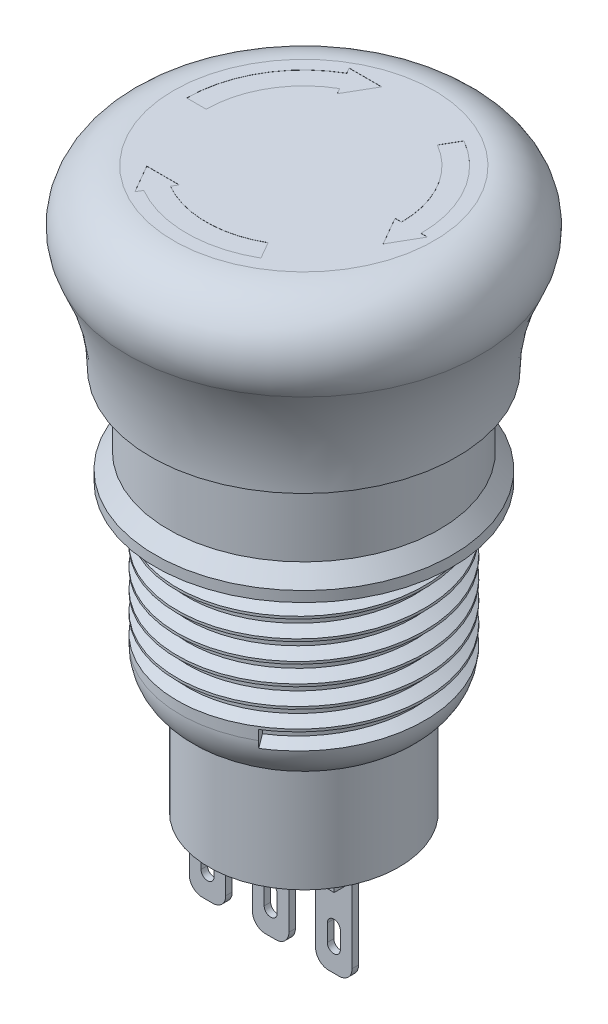
from build123d import *
from build123d.topology import SkipClean

# Parameters (mm, degrees)
SKETCH5_R                   = 7.3
BOSS_EXTRUDE1_DEPTH         = 8
SKETCH7_W                   = 2.8
SKETCH7_H                   = 0.5
BOSS_EXTRUDE3_DEPTH         = 7
CUT_EXTRUDE1_REACH          = 44.259
BOSS_EXTRUDE4_DEPTH         = 0.1
SKETCH6_W                   = 12
SKETCH6_H                   = 2.75
Y_KSEKLIK_EKSTR_ZYON1_DEPTH = 0.5
RADYUS1_R                   = 1
RADYUS2_R                   = 3.5
KES_EKSTR_ZYON1_DEPTH       = 0.01
DI_1_PITCH                  = 1.5


with BuildPart() as part:
    # Sketch1 → Revolve1 (revolve)
    with BuildSketch(Plane.XY):
        with BuildLine():
            Line((0, 0), (-11.75, 0))
            ThreePointArc((-11.75, 0), (-12.212495616, 3.959540512), (-13.575081967, 7.705901639))
            ThreePointArc((-13.575081967, 7.705901639), (-13.404144051, 11.600429308), (-10, 13.5))
            Line((-10, 13.5), (0, 13.5))
            Line((0, 13.5), (0, 0))
        make_face()
    revolve(axis=Axis((0, 13.5, 0), (0, -1, 0)))

    # Sketch2 → Revolve2 (revolve)
    with BuildSketch(Plane.XY, mode=Mode.PRIVATE) as revolve2_sk:
        Polygon((0, 0), (-10.4, 0), (-10.4, -5.5), (-11.4, -6.7), (-11.4, -7.5), (-9.5, -7.5), (-9.5, -21.5), (0, -21.5), align=None)
    revolve(revolve2_sk.sketch.rotate(Axis((0, -21.5, 0), (0, 1, 0)), 270), axis=Axis((0, -21.5, 0), (0, 1, 0)))

    # Sketch5 → Boss-Extrude1 (add)
    with BuildSketch(Plane.XZ.offset(21.5)):
        with Locations(Location((0, 0, 0), (0, 0, 270))):
            Circle(SKETCH5_R)
    extrude(amount=BOSS_EXTRUDE1_DEPTH)

    # Sketch7 → Boss-Extrude3 (add)
    with BuildSketch(Plane.XZ.offset(29.5)):
        with Locations((-4.85, 2.3)):
            Rectangle(SKETCH7_W, SKETCH7_H)
        with Locations((0, 2.3)):
            Rectangle(SKETCH7_W, SKETCH7_H)
        with Locations((4.85, 2.3)):
            Rectangle(SKETCH7_W, SKETCH7_H)
    extrude(amount=BOSS_EXTRUDE3_DEPTH)

    # Sketch8 → Cut-Extrude1 (cut, up to next)
    with BuildSketch(Plane(origin=(0, 0, 2.05), x_dir=(-1, 0, 0), z_dir=(0, 0, -1)), mode=Mode.PRIVATE) as cut_extrude1_sk1:
        with BuildLine():
            Line((-4.35, -33.4), (-4.35, -34.7))
            ThreePointArc((-4.35, -34.7), (-4.85, -35.2), (-5.35, -34.7))
            Line((-5.35, -34.7), (-5.35, -33.4))
            ThreePointArc((-5.35, -33.4), (-4.85, -32.9), (-4.35, -33.4))
        make_face()
    cut_extrude1_tool1 = extrude(cut_extrude1_sk1.sketch, amount=-CUT_EXTRUDE1_REACH, mode=Mode.PRIVATE) & part.part
    # Sketch8 → Cut-Extrude1 (cut, up to next)
    with BuildSketch(Plane(origin=(0, 0, 2.05), x_dir=(-1, 0, 0), z_dir=(0, 0, -1)), mode=Mode.PRIVATE) as cut_extrude1_sk2:
        with BuildLine():
            Line((0.5, -33.4), (0.5, -34.7))
            ThreePointArc((0.5, -34.7), (0, -35.2), (-0.5, -34.7))
            Line((-0.5, -34.7), (-0.5, -33.4))
            ThreePointArc((-0.5, -33.4), (0, -32.9), (0.5, -33.4))
        make_face()
    cut_extrude1_tool2 = extrude(cut_extrude1_sk2.sketch, amount=-CUT_EXTRUDE1_REACH, mode=Mode.PRIVATE) & part.part
    # Sketch8 → Cut-Extrude1 (cut, up to next)
    with BuildSketch(Plane(origin=(0, 0, 2.05), x_dir=(-1, 0, 0), z_dir=(0, 0, -1)), mode=Mode.PRIVATE) as cut_extrude1_sk3:
        with BuildLine():
            Line((5.35, -33.4), (5.35, -34.7))
            ThreePointArc((5.35, -34.7), (4.85, -35.2), (4.35, -34.7))
            Line((4.35, -34.7), (4.35, -33.4))
            ThreePointArc((4.35, -33.4), (4.85, -32.9), (5.35, -33.4))
        make_face()
    cut_extrude1_tool3 = extrude(cut_extrude1_sk3.sketch, amount=-CUT_EXTRUDE1_REACH, mode=Mode.PRIVATE) & part.part
    add(cut_extrude1_tool1.solids().sort_by_distance((4.85, -34.05, 2.05))[0], mode=Mode.SUBTRACT)
    add(cut_extrude1_tool2.solids().sort_by_distance((0, -34.05, 2.05))[0], mode=Mode.SUBTRACT)
    add(cut_extrude1_tool3.solids().sort_by_distance((-4.85, -34.05, 2.05))[0], mode=Mode.SUBTRACT)

    # Sketch10 → Boss-Extrude4 (add)
    # profile 1 of 5: a face of its own
    with BuildSketch(Plane.XZ.offset(29.5)):
        Polygon((-5.694051878, 0.467037209), (-4.106551878, 0.467037209), (-4.106551878, 0.437144381), (-5.356008508, -0.611648688), (-4.106551878, -0.611648688), (-4.106551878, -0.754116637), (-5.694051878, -0.754116637), (-5.694051878, -0.721679738), (-4.447457326, 0.32456926), (-5.694051878, 0.32456926), align=None)
    # profile 2 of 5: a face of its own
    with BuildSketch(Plane.XZ.offset(29.5)):
        with BuildLine():
            Line((-4.397847951, -2.626552534), (-4.493250596, -2.501893079))
            add(Edge.make_bspline(
                [(-4.493250596, -2.501893079), (-4.482652459, -2.493000408), (-4.461599073, -2.475334959), (-4.432035493, -2.446914535), (-4.404338036, -2.417295576), (-4.378374755, -2.386489403), (-4.355053579, -2.353941517), (-4.333159185, -2.320440369), (-4.313534176, -2.285425541), (-4.289738464, -2.237006004), (-4.264907172, -2.17366573), (-4.244086778, -2.093930214), (-4.230832888, -2.010694823), (-4.229397406, -1.953908769), (-4.228667262, -1.92502509)],
                knots=[0, 0, 0, 0, 0.757959112, 1.505699292, 2.245454638, 2.979532153, 3.711538275, 4.438200793, 5.171680507, 5.909471876, 7.393775596, 8.890124382, 10.418191784, 12, 12, 12, 12], degree=3))
            add(Edge.make_bspline(
                [(-4.228667262, -1.92502509), (-4.228851315, -1.909112502), (-4.229217712, -1.877435008), (-4.234017507, -1.830420167), (-4.240841369, -1.784194193), (-4.250720327, -1.738928984), (-4.263581834, -1.694714416), (-4.278664949, -1.651213832), (-4.297434354, -1.608939552), (-4.318162656, -1.567382817), (-4.341581828, -1.527570513), (-4.367118019, -1.489893252), (-4.394520596, -1.454523163), (-4.423718823, -1.421362236), (-4.455075576, -1.39077415), (-4.48822198, -1.362268688), (-4.523556994, -1.336359583), (-4.560417938, -1.312410165), (-4.598858991, -1.291099467), (-4.638638328, -1.272696648), (-4.679603856, -1.256923901), (-4.721839497, -1.24432761), (-4.765179043, -1.234392128), (-4.809714471, -1.227528245), (-4.855359334, -1.222771629), (-4.886297088, -1.222408603), (-4.901891922, -1.222225611)],
                knots=[0, 0, 0, 0, 1.055000685, 2.100209969, 3.131349012, 4.153242145, 5.170189196, 6.184191144, 7.204341339, 8.235672124, 9.263040994, 10.265373269, 11.252624173, 12.22887325, 13.193405896, 14.155809299, 15.126090485, 16.097288279, 17.069732292, 18.038585918, 19.002221264, 19.978698174, 20.959418239, 21.948869816, 22.966084182, 24, 24, 24, 24], degree=3))
            add(Edge.make_bspline(
                [(-4.901891922, -1.222225611), (-4.92535577, -1.222797936), (-4.971423925, -1.223921621), (-5.038902023, -1.233922115), (-5.103545329, -1.249119067), (-5.164949757, -1.271895418), (-5.223872477, -1.29998013), (-5.279316528, -1.335467836), (-5.332119756, -1.376568909), (-5.381034236, -1.423864806), (-5.425717247, -1.475756015), (-5.465064832, -1.531430961), (-5.497864797, -1.590750977), (-5.525158887, -1.653061092), (-5.546139617, -1.718840793), (-5.560909773, -1.787971793), (-5.570544619, -1.860303734), (-5.571467042, -1.90972914), (-5.571936493, -1.934883364)],
                knots=[0, 0, 0, 0, 1.029171465, 2.020641659, 2.987623507, 3.938342917, 4.889210282, 5.84687017, 6.821220943, 7.821438502, 8.827599549, 9.822697543, 10.807740252, 11.797342354, 12.80366471, 13.83203677, 14.896651826, 16, 16, 16, 16], degree=3))
            add(Edge.make_bspline(
                [(-5.571936493, -1.934883364), (-5.571170511, -1.962597798), (-5.569662875, -2.017146433), (-5.556890644, -2.097141931), (-5.536181517, -2.173721011), (-5.507199245, -2.246887791), (-5.469523203, -2.316436005), (-5.423849523, -2.382474491), (-5.369743744, -2.445058989), (-5.328431039, -2.482692392), (-5.30735316, -2.501893079)],
                knots=[0, 0, 0, 0, 1.028121516, 2.023589091, 2.998037872, 3.967518031, 4.937445131, 5.927275754, 6.942489185, 8, 8, 8, 8], degree=3))
            Line((-5.30735316, -2.501893079), (-5.401801778, -2.626552534))
            add(Edge.make_bspline(
                [(-5.401801778, -2.626552534), (-5.414746026, -2.616520405), (-5.440572521, -2.5965042), (-5.476981147, -2.564092687), (-5.511228846, -2.529949794), (-5.54303217, -2.493817494), (-5.573055047, -2.456127932), (-5.600290983, -2.416217223), (-5.62556963, -2.374774704), (-5.64840987, -2.331559089), (-5.668888651, -2.286712262), (-5.686177405, -2.240280894), (-5.701284551, -2.192658353), (-5.713630864, -2.143820658), (-5.723282737, -2.093604654), (-5.7297313, -2.042182635), (-5.734150244, -1.989446052), (-5.734552938, -1.95386725), (-5.734757006, -1.93583739)],
                knots=[0, 0, 0, 0, 0.986756325, 1.968786143, 2.935506311, 3.899499537, 4.868307269, 5.8376204, 6.809456583, 7.792545619, 8.781780509, 9.778496008, 10.776623214, 11.79151764, 12.812666265, 13.856269958, 14.913646641, 16, 16, 16, 16], degree=3))
            add(Edge.make_bspline(
                [(-5.734757006, -1.93583739), (-5.734638174, -1.918763298), (-5.734403197, -1.885001396), (-5.73059675, -1.835154462), (-5.725403476, -1.786627045), (-5.717583846, -1.73955784), (-5.708356234, -1.693689987), (-5.695986771, -1.649439293), (-5.682130542, -1.606370323), (-5.665845066, -1.564656111), (-5.647468083, -1.524261176), (-5.626698341, -1.485315804), (-5.603710495, -1.447837908), (-5.579011258, -1.411459021), (-5.551807267, -1.376716545), (-5.52247633, -1.343309411), (-5.491117303, -1.311050288), (-5.468504566, -1.291091927), (-5.457135311, -1.281057242)],
                knots=[0, 0, 0, 0, 1.114604814, 2.203992996, 3.262667896, 4.300477797, 5.318619304, 6.316056647, 7.298880507, 8.271930387, 9.238335007, 10.195173496, 11.151986948, 12.108099108, 13.064862484, 14.031167946, 15.010108607, 16, 16, 16, 16], degree=3))
            add(Edge.make_bspline(
                [(-5.457135311, -1.281057242), (-5.437386272, -1.264984646), (-5.398126621, -1.233033498), (-5.334496908, -1.192155063), (-5.268063113, -1.157163136), (-5.198476217, -1.128871201), (-5.125892367, -1.106753818), (-5.050274973, -1.091431633), (-4.971694656, -1.081475013), (-4.918247255, -1.080336417), (-4.891079622, -1.079757663)],
                knots=[0, 0, 0, 0, 0.994628077, 1.977248131, 2.950237994, 3.925870899, 4.908910175, 5.911660606, 6.938484602, 8, 8, 8, 8], degree=3))
            add(Edge.make_bspline(
                [(-4.891079622, -1.079757663), (-4.862526022, -1.080466209), (-4.806348596, -1.08186023), (-4.723884073, -1.093606149), (-4.644990917, -1.112730775), (-4.569365565, -1.139065513), (-4.497440717, -1.173808072), (-4.428912604, -1.215866751), (-4.363837182, -1.265652359), (-4.303046445, -1.322539638), (-4.247467576, -1.384939538), (-4.198569375, -1.451758284), (-4.157876176, -1.522870322), (-4.123860032, -1.597490858), (-4.097714158, -1.676179023), (-4.079411103, -1.758766833), (-4.068018697, -1.845099127), (-4.066578514, -1.904001013), (-4.06584675, -1.933929337)],
                knots=[0, 0, 0, 0, 1.032901378, 2.032168977, 3.007206631, 3.966850309, 4.924221947, 5.891988639, 6.871730993, 7.884084801, 8.900290346, 9.89161143, 10.874607481, 11.860025555, 12.854717796, 13.869097222, 14.917278314, 16, 16, 16, 16], degree=3))
            add(Edge.make_bspline(
                [(-4.06584675, -1.933929337), (-4.06606527, -1.952169508), (-4.06649781, -1.98827409), (-4.070721179, -2.041682811), (-4.077748999, -2.0936832), (-4.087377587, -2.144401012), (-4.099179008, -2.194020161), (-4.114627981, -2.242031591), (-4.132568025, -2.288696743), (-4.152703152, -2.334050566), (-4.175722215, -2.377599625), (-4.200723331, -2.419335993), (-4.228283608, -2.458756199), (-4.257491903, -2.496601739), (-4.289440799, -2.532020589), (-4.323089854, -2.566024304), (-4.359437555, -2.597438267), (-4.385021048, -2.616830014), (-4.397847951, -2.626552534)],
                knots=[0, 0, 0, 0, 1.096705196, 2.170817488, 3.219277236, 4.250701065, 5.274195539, 6.284202015, 7.28098643, 8.279664616, 9.266225751, 10.241373748, 11.203306326, 12.157093976, 13.114198862, 14.069774147, 15.032234603, 16, 16, 16, 16], degree=3))
        make_face()
    # profile 3 of 5: a face of its own
    with BuildSketch(Plane.XZ.offset(29.5)):
        Polygon((-0.8, 0.467037209), (0.7875, 0.467037209), (0.7875, 0.437144381), (-0.461956631, -0.611648688), (0.7875, -0.611648688), (0.7875, -0.754116637), (-0.8, -0.754116637), (-0.8, -0.721679738), (0.446594551, 0.32456926), (-0.8, 0.32456926), align=None)
    # profile 4 of 5: a face of its own
    with BuildSketch(Plane.XZ.offset(29.5)):
        with BuildLine():
            add(Edge.make_bspline(
                [(0.828205128, -1.904036509), (0.827460593, -1.933431608), (0.825998265, -1.991166008), (0.814804625, -2.076017921), (0.795438863, -2.157023245), (0.769648727, -2.234843682), (0.735238586, -2.308541705), (0.693670663, -2.378697038), (0.644353762, -2.445111326), (0.5881154, -2.507175802), (0.526702721, -2.563762185), (0.46097539, -2.613201318), (0.39183344, -2.655001731), (0.319036276, -2.689262599), (0.242904304, -2.716164879), (0.16300465, -2.734722918), (0.079862309, -2.746578892), (0.023153649, -2.747964843), (-0.005613982, -2.748667919)],
                knots=[0, 0, 0, 0, 1.06508495, 2.091914715, 3.094501328, 4.079693967, 5.057647778, 6.035986298, 7.030177474, 8.050107388, 9.066943579, 10.051896531, 11.025616101, 11.9896488, 12.96281505, 13.945825876, 14.957941789, 16, 16, 16, 16], degree=3))
            add(Edge.make_bspline(
                [(-0.005613982, -2.748667919), (-0.034169706, -2.747964947), (-0.090456345, -2.746579308), (-0.173071054, -2.734709424), (-0.252488488, -2.716096138), (-0.328568358, -2.689512152), (-0.401419526, -2.655415873), (-0.470688566, -2.61333295), (-0.536871, -2.564221136), (-0.59858181, -2.507830339), (-0.655279356, -2.446432305), (-0.704795353, -2.380519627), (-0.747110429, -2.311445723), (-0.781136305, -2.238692566), (-0.808228979, -2.163071233), (-0.826718143, -2.083888658), (-0.83863985, -2.001498159), (-0.840009148, -1.945313923), (-0.840705128, -1.916756861)],
                knots=[0, 0, 0, 0, 1.04355943, 2.056976533, 3.044937463, 4.02179873, 4.997890911, 5.980248884, 6.980147982, 8.006253959, 9.032111064, 10.031228745, 11.015595249, 11.988180414, 12.962670953, 13.946861971, 14.95644057, 16, 16, 16, 16], degree=3))
            add(Edge.make_bspline(
                [(-0.840705128, -1.916756861), (-0.840002465, -1.887989346), (-0.838617328, -1.831280916), (-0.826740839, -1.748034567), (-0.808175992, -1.668077061), (-0.781619643, -1.591654586), (-0.747427885, -1.518742063), (-0.705411292, -1.449346545), (-0.655900508, -1.38338464), (-0.599584788, -1.321527589), (-0.538157247, -1.264998606), (-0.472677817, -1.215278101), (-0.403769244, -1.173503743), (-0.331715583, -1.139297551), (-0.256703081, -1.112241755), (-0.17825988, -1.093777503), (-0.096825541, -1.081832732), (-0.041379703, -1.080456148), (-0.013246194, -1.079757663)],
                knots=[0, 0, 0, 0, 1.053167129, 2.076072758, 3.073341244, 4.055601477, 5.033424535, 6.017524495, 7.021518915, 8.049444456, 9.077120685, 10.074910483, 11.055688766, 12.022980584, 12.991883888, 13.970269434, 14.970104079, 16, 16, 16, 16], degree=3))
            add(Edge.make_bspline(
                [(-0.013246194, -1.079757663), (0.005637282, -1.079999936), (0.043166009, -1.080481425), (0.098893519, -1.086286643), (0.153730826, -1.094693439), (0.207493595, -1.106804717), (0.260190605, -1.122427238), (0.311714088, -1.141679345), (0.362488445, -1.163742267), (0.411547351, -1.190011223), (0.458967807, -1.218671441), (0.504156859, -1.249922529), (0.54630731, -1.283982384), (0.586096449, -1.320364469), (0.622845166, -1.359572394), (0.657354668, -1.40101608), (0.689267726, -1.444912381), (0.717914076, -1.491330718), (0.744226097, -1.53908764), (0.766194469, -1.588529624), (0.785611564, -1.638613495), (0.801042397, -1.68978041), (0.813322345, -1.741912013), (0.82166626, -1.795073473), (0.827484377, -1.849210036), (0.827963844, -1.885682388), (0.828205128, -1.904036509)],
                knots=[0, 0, 0, 0, 1.037115869, 2.061148057, 3.07517727, 4.084041727, 5.086514338, 6.092668487, 7.104487461, 8.125783165, 9.147610153, 10.147694368, 11.141876323, 12.122903372, 13.107606018, 14.091946891, 15.084523921, 16.086505767, 17.087268121, 18.077809654, 19.05670789, 20.036870126, 21.011670792, 21.99694167, 22.991993299, 24, 24, 24, 24], degree=3))
        make_face()
        with BuildLine():
            add(Edge.make_bspline(
                [(0.665384615, -1.911032703), (0.665201056, -1.895967459), (0.664835693, -1.865980998), (0.660019415, -1.821402449), (0.653161796, -1.777407764), (0.643354876, -1.733999339), (0.63011589, -1.691410769), (0.614516569, -1.649216751), (0.596166332, -1.607619886), (0.574769499, -1.567085196), (0.551395782, -1.527680435), (0.525742318, -1.490242634), (0.497933498, -1.45514526), (0.468336659, -1.422275883), (0.436650664, -1.391730285), (0.403381225, -1.362889284), (0.367570598, -1.336913653), (0.330191675, -1.313107637), (0.29129265, -1.291804382), (0.251283182, -1.272860806), (0.209836873, -1.257364989), (0.16740338, -1.244727411), (0.124049908, -1.234249997), (0.079447576, -1.227612467), (0.033820507, -1.222744575), (0.002985881, -1.222399931), (-0.012610176, -1.222225611)],
                knots=[0, 0, 0, 0, 1.008585988, 2.007529826, 2.999688727, 3.990042337, 4.984966365, 5.984641633, 7.001812546, 8.027570247, 9.052811818, 10.068991095, 11.064725446, 12.050001529, 13.029093193, 14.010961114, 14.996492974, 15.989185205, 16.977398719, 17.96520407, 18.951579521, 19.937648295, 20.929603947, 21.935788061, 22.955928099, 24, 24, 24, 24], degree=3))
            add(Edge.make_bspline(
                [(-0.012610176, -1.222225611), (-0.035543755, -1.222803852), (-0.080661199, -1.223941431), (-0.146777464, -1.233900758), (-0.210317509, -1.249241439), (-0.27093366, -1.271855316), (-0.32914696, -1.300135773), (-0.384440993, -1.33507297), (-0.436830704, -1.376465484), (-0.485950344, -1.423484297), (-0.530783977, -1.474884239), (-0.57013738, -1.529463728), (-0.603434172, -1.586638042), (-0.630560044, -1.646556281), (-0.652054675, -1.708898557), (-0.666786054, -1.774066589), (-0.67648135, -1.841626262), (-0.677412421, -1.887677667), (-0.677884615, -1.911032703)],
                knots=[0, 0, 0, 0, 1.032063989, 2.030389145, 3.003944642, 3.970395727, 4.937377036, 5.913328081, 6.909231446, 7.93887556, 8.970685674, 9.976071282, 10.964166581, 11.944589148, 12.933237628, 13.927779006, 14.949070134, 16, 16, 16, 16], degree=3))
            add(Edge.make_bspline(
                [(-0.677884615, -1.911032703), (-0.677668941, -1.926730584), (-0.677241193, -1.957864198), (-0.672932856, -2.004171803), (-0.66602415, -2.049645181), (-0.656076902, -2.094220403), (-0.643628111, -2.137847422), (-0.628836398, -2.180706312), (-0.610391267, -2.222348111), (-0.589978885, -2.263269598), (-0.566876014, -2.302446728), (-0.541581134, -2.339616305), (-0.514269644, -2.374562841), (-0.48492982, -2.407362029), (-0.453814578, -2.438119275), (-0.420123894, -2.465999389), (-0.384841692, -2.492286205), (-0.347375582, -2.515996899), (-0.308394585, -2.537257799), (-0.268233567, -2.55574547), (-0.227030547, -2.571439558), (-0.184715691, -2.584106516), (-0.141372146, -2.594033302), (-0.096941126, -2.600873078), (-0.051511719, -2.605657561), (-0.02078504, -2.606018183), (-0.005295974, -2.60619997)],
                knots=[0, 0, 0, 0, 1.047226202, 2.076964084, 3.100341814, 4.114585567, 5.122123135, 6.126552355, 7.137064942, 8.158803602, 9.176592812, 10.169297945, 11.156925011, 12.133779169, 13.104132798, 14.073170763, 15.049307625, 16.038276215, 17.028988595, 18.010110019, 18.986169996, 19.968539974, 20.955178716, 21.950601663, 22.966915103, 24, 24, 24, 24], degree=3))
            add(Edge.make_bspline(
                [(-0.005295974, -2.60619997), (0.01008713, -2.606018037), (0.04060235, -2.605657139), (0.085714936, -2.600875373), (0.129826214, -2.594026041), (0.17276301, -2.584155098), (0.21453627, -2.57143235), (0.255106759, -2.555744525), (0.294625619, -2.537245479), (0.332995175, -2.516014605), (0.369813717, -2.492149571), (0.405011953, -2.466071825), (0.437928877, -2.437331114), (0.469377108, -2.406748594), (0.498685953, -2.373560376), (0.525865034, -2.337916767), (0.551570651, -2.300250596), (0.574758829, -2.260369052), (0.596177285, -2.219211169), (0.614512076, -2.176973724), (0.630183355, -2.134061207), (0.643300687, -2.090693327), (0.653171404, -2.046564577), (0.660016954, -2.001931936), (0.664836208, -1.956719116), (0.665201233, -1.926309833), (0.665384615, -1.911032703)],
                knots=[0, 0, 0, 0, 1.029967493, 2.04313025, 3.035375922, 4.01889446, 4.991458755, 5.958017022, 6.930036849, 7.912118993, 8.892942568, 9.867138445, 10.843712051, 11.817804417, 12.803729339, 13.806387533, 14.818654169, 15.856205545, 16.894655496, 17.924916651, 18.938004761, 19.953404357, 20.957695443, 21.963967554, 22.97713031, 24, 24, 24, 24], degree=3))
        make_face(mode=Mode.SUBTRACT)
    # profile 5 of 5: a face of its own
    with BuildSketch(Plane.XZ.offset(29.5)):
        with BuildLine():
            Line((5.644130399, -1.902297009), (5.532827314, -1.756860978))
            add(Edge.make_bspline(
                [(5.532827314, -1.756860978), (5.545191806, -1.746486195), (5.569754091, -1.725876504), (5.604244933, -1.692719343), (5.636558634, -1.65816389), (5.666849129, -1.622223355), (5.694057167, -1.584250821), (5.719600626, -1.545166149), (5.742496471, -1.504315516), (5.770258134, -1.447826057), (5.799227974, -1.37392907), (5.823518434, -1.280904301), (5.838981306, -1.183796345), (5.840656035, -1.117545949), (5.84150787, -1.083848324)],
                knots=[0, 0, 0, 0, 0.757959112, 1.505699292, 2.245454638, 2.979532153, 3.711538275, 4.438200793, 5.171680507, 5.909471876, 7.393775596, 8.890124382, 10.418191784, 12, 12, 12, 12], degree=3))
            add(Edge.make_bspline(
                [(5.84150787, -1.083848324), (5.841293142, -1.065283637), (5.840865678, -1.028326561), (5.835265918, -0.973475914), (5.827304745, -0.919545611), (5.815779294, -0.8667362), (5.800774203, -0.815152538), (5.783177236, -0.764401856), (5.761279596, -0.715081863), (5.737096577, -0.666599005), (5.709774209, -0.620151317), (5.679981986, -0.576194512), (5.648012314, -0.534929409), (5.613947716, -0.49624166), (5.577364837, -0.46055556), (5.538694032, -0.427299187), (5.49746985, -0.397071899), (5.454465415, -0.369130911), (5.409617519, -0.34426843), (5.363208293, -0.322798474), (5.315415177, -0.304396936), (5.266140262, -0.289701263), (5.215577459, -0.278109868), (5.16361946, -0.270102005), (5.110367119, -0.264552619), (5.074273073, -0.264129088), (5.0560791, -0.263915598)],
                knots=[0, 0, 0, 0, 1.055000685, 2.100209969, 3.131349012, 4.153242145, 5.170189196, 6.184191144, 7.204341339, 8.235672124, 9.263040994, 10.265373269, 11.252624173, 12.22887325, 13.193405896, 14.155809299, 15.126090485, 16.097288279, 17.069732292, 18.038585918, 19.002221264, 19.978698174, 20.959418239, 21.948869816, 22.966084182, 24, 24, 24, 24], degree=3))
            add(Edge.make_bspline(
                [(5.0560791, -0.263915598), (5.02870461, -0.264583311), (4.97495843, -0.265894276), (4.896233982, -0.277561519), (4.820816792, -0.295291297), (4.749178292, -0.321863706), (4.680435119, -0.354629204), (4.615750393, -0.396031527), (4.554146627, -0.443982778), (4.497079734, -0.499161325), (4.444949554, -0.55970107), (4.399044038, -0.624655173), (4.360777413, -0.693861859), (4.328934308, -0.766556992), (4.30445679, -0.843299977), (4.287224941, -0.92395281), (4.275984287, -1.008340074), (4.274908127, -1.066003049), (4.274360434, -1.095349643)],
                knots=[0, 0, 0, 0, 1.029171465, 2.020641659, 2.987623507, 3.938342917, 4.889210282, 5.84687017, 6.821220943, 7.821438502, 8.827599549, 9.822697543, 10.807740252, 11.797342354, 12.80366471, 13.83203677, 14.896651826, 16, 16, 16, 16], degree=3))
            add(Edge.make_bspline(
                [(4.274360434, -1.095349643), (4.27525408, -1.127683149), (4.277012989, -1.191323224), (4.291913925, -1.284651305), (4.316074573, -1.373993564), (4.349887223, -1.459354808), (4.393842605, -1.540494391), (4.447128565, -1.617539291), (4.510251975, -1.690554539), (4.55845013, -1.734460175), (4.583040989, -1.756860978)],
                knots=[0, 0, 0, 0, 1.028121516, 2.023589091, 2.998037872, 3.967518031, 4.937445131, 5.927275754, 6.942489185, 8, 8, 8, 8], degree=3))
            Line((4.583040989, -1.756860978), (4.472850935, -1.902297009))
            add(Edge.make_bspline(
                [(4.472850935, -1.902297009), (4.457749312, -1.890592858), (4.427618401, -1.867240618), (4.385141671, -1.829427187), (4.345186022, -1.789593811), (4.308082144, -1.747439462), (4.273055454, -1.703468305), (4.241280195, -1.656905812), (4.211788441, -1.608556206), (4.185141495, -1.558137989), (4.161249583, -1.505816691), (4.14107937, -1.451646761), (4.123454366, -1.396087131), (4.109050334, -1.33910982), (4.097789816, -1.280524482), (4.090266493, -1.220532126), (4.085111058, -1.159006113), (4.084641249, -1.11749751), (4.084403169, -1.096462674)],
                knots=[0, 0, 0, 0, 0.986756325, 1.968786143, 2.935506311, 3.899499537, 4.868307269, 5.8376204, 6.809456583, 7.792545619, 8.781780509, 9.778496008, 10.776623214, 11.79151764, 12.812666265, 13.856269958, 14.913646641, 16, 16, 16, 16], degree=3))
            add(Edge.make_bspline(
                [(4.084403169, -1.096462674), (4.084541807, -1.0765429), (4.084815945, -1.037154014), (4.089256801, -0.978999258), (4.09531562, -0.922383938), (4.104438523, -0.867469865), (4.115204069, -0.81395737), (4.129635109, -0.762331561), (4.14580071, -0.712084428), (4.164800432, -0.663417848), (4.186240245, -0.616290424), (4.210471612, -0.570854157), (4.237290765, -0.527129945), (4.266106541, -0.48468791), (4.29784453, -0.444155021), (4.332063958, -0.405180031), (4.368649488, -0.367544387), (4.395031015, -0.344259633), (4.408295146, -0.332552501)],
                knots=[0, 0, 0, 0, 1.114604814, 2.203992996, 3.262667896, 4.300477797, 5.318619304, 6.316056647, 7.298880507, 8.271930387, 9.238335007, 10.195173496, 11.151986948, 12.108099108, 13.064862484, 14.031167946, 15.010108607, 16, 16, 16, 16], degree=3))
            add(Edge.make_bspline(
                [(4.408295146, -0.332552501), (4.431335692, -0.313801139), (4.477138618, -0.276524799), (4.551373283, -0.228833292), (4.628879377, -0.188009377), (4.710064089, -0.155002119), (4.794745248, -0.129198506), (4.882965541, -0.111322624), (4.974642577, -0.099706567), (5.036997878, -0.098378205), (5.06869345, -0.097702991)],
                knots=[0, 0, 0, 0, 0.994628077, 1.977248131, 2.950237994, 3.925870899, 4.908910175, 5.911660606, 6.938484602, 8, 8, 8, 8], degree=3))
            add(Edge.make_bspline(
                [(5.06869345, -0.097702991), (5.102005984, -0.098529629), (5.167546314, -0.100155986), (5.263754924, -0.113859559), (5.35579694, -0.136171623), (5.444026517, -0.166895483), (5.527938839, -0.20742847), (5.607888304, -0.256496928), (5.68380963, -0.314580138), (5.754732157, -0.38094863), (5.81957417, -0.453748513), (5.876622071, -0.531703716), (5.924097471, -0.614667761), (5.963782972, -0.701725053), (5.994286492, -0.793527912), (6.015640056, -0.889880357), (6.028931196, -0.990601367), (6.03061141, -1.059320234), (6.031465135, -1.094236612)],
                knots=[0, 0, 0, 0, 1.032901378, 2.032168977, 3.007206631, 3.966850309, 4.924221947, 5.891988639, 6.871730993, 7.884084801, 8.900290346, 9.89161143, 10.874607481, 11.860025555, 12.854717796, 13.869097222, 14.917278314, 16, 16, 16, 16], degree=3))
            add(Edge.make_bspline(
                [(6.031465135, -1.094236612), (6.031210194, -1.115516812), (6.030705564, -1.157638824), (6.0257783, -1.219948998), (6.017579177, -1.280616118), (6.006345825, -1.339786899), (5.9925775, -1.397675906), (5.974553698, -1.453689241), (5.953623647, -1.508131919), (5.930132665, -1.561044712), (5.903277092, -1.611851947), (5.874109123, -1.660544377), (5.841955466, -1.706534617), (5.807879122, -1.750687747), (5.77060541, -1.792009739), (5.731348179, -1.83168074), (5.688942529, -1.868330364), (5.659095119, -1.890954068), (5.644130399, -1.902297009)],
                knots=[0, 0, 0, 0, 1.096705196, 2.170817488, 3.219277236, 4.250701065, 5.274195539, 6.284202015, 7.28098643, 8.279664616, 9.266225751, 10.241373748, 11.203306326, 12.157093976, 13.114198862, 14.069774147, 15.032234603, 16, 16, 16, 16], degree=3))
        make_face()
    extrude(amount=BOSS_EXTRUDE4_DEPTH)

    # Sketch6 → Yükseklik-Ekstrüzyon1 (add)
    with BuildSketch(Plane.XZ.offset(29.5)):
        with Locations((0, 2.3)):
            Rectangle(SKETCH6_W, SKETCH6_H)
    extrude(amount=Y_KSEKLIK_EKSTR_ZYON1_DEPTH)

    # Radyus1
    radyus1_edges = [part.edges().sort_by_distance(p)[0] for p in [
        (1.4, -36.5, 2.3),
        (-1.4, -36.5, 2.3),
        (-3.45, -36.5, 2.3),
        (-6.25, -36.5, 2.3),
        (6.25, -36.5, 2.3),
        (3.45, -36.5, 2.3),
    ]]
    fillet(radyus1_edges, radius=RADYUS1_R)

    # Radyus2
    # the kernel refuses this fillet: 3.5 mm, written as the material it takes off along each edge
    with BuildSketch(Plane(origin=(0, -21.5, 0), x_dir=(0, 0, -1), z_dir=(1, 0, 0))) as radyus2_piece_1:
        with BuildLine():
            CenterArc((6, 3.249615362), RADYUS2_R, 291.803747989, 68.196252011)
            Line((9.5, 3.249615362), (9.57, 3.249615362))
            Line((9.57, 3.249615362), (9.57, 0))
            Line((9.57, 0), (9.5, -0.07))
            ThreePointArc((9.5, -0.07), (8.4, -0.07), (7.326, -0.064992307))
            Line((7.326, -0.064992307), (7.3, 0))
        make_face()
    revolve(axis=Axis((0, -21.5, 0), (0, 1, 0)), mode=Mode.SUBTRACT)

    # Çizim1 → Kes-Ekstrüzyon1 (cut)
    with BuildSketch(Plane(origin=(0, 13.5, 0), x_dir=(1, 0, 0), z_dir=(0, 1, 0))):
        with BuildLine():
            Line((-9, 0), (-7.5, 0))
            ThreePointArc((-7.5, 0), (-6.495190528, 3.75), (-3.75, 6.495190528))
            Line((-3.75, 6.495190528), (-3.5, 6.062177826))
            Line((-3.5, 6.062177826), (-2.25, 8.227241336))
            Line((-2.25, 8.227241336), (-4.75, 8.227241336))
            Line((-4.75, 8.227241336), (-4.5, 7.794228634))
            ThreePointArc((-4.5, 7.794228634), (-7.794228634, 4.5), (-9, 0))
        make_face()
        with BuildLine():
            Line((4.5, 7.794228634), (3.75, 6.495190528))
            ThreePointArc((3.75, 6.495190528), (6.495190528, 3.75), (7.5, 0))
            Line((7.5, 0), (7, 0))
            Line((7, 0), (8.25, -2.165063509))
            Line((8.25, -2.165063509), (9.5, 0))
            Line((9.5, 0), (9, 0))
            ThreePointArc((9, 0), (7.794228634, 4.5), (4.5, 7.794228634))
        make_face()
        with BuildLine():
            Line((4.5, -7.794228634), (3.75, -6.495190528))
            ThreePointArc((3.75, -6.495190528), (0, -7.5), (-3.75, -6.495190528))
            Line((-3.75, -6.495190528), (-3.5, -6.062177826))
            Line((-3.5, -6.062177826), (-6, -6.062177826))
            Line((-6, -6.062177826), (-4.75, -8.227241336))
            Line((-4.75, -8.227241336), (-4.5, -7.794228634))
            ThreePointArc((-4.5, -7.794228634), (0, -9), (4.5, -7.794228634))
        make_face()
    extrude(amount=-KES_EKSTR_ZYON1_DEPTH, mode=Mode.SUBTRACT)

    # Diş1: the profile of Diş Profili1 profile screwed along a right-hand helix of 6.666667 turns, 8 arcs to a turn; built about Z, then put on its axis
    with SkipClean():  # the faces are left unmerged after this step: merging them gives an invalid solid
        di_1_z = Axis((0, 0, 0), (0, 0, 1))
        di_1_corners = [(9.5003, 0, -0.000173205), (9.5003, 0, 1.312673201), (8.688101188, 0, 0.843749998), (8.688101188, 0, 0.468749998)]
        with BuildLine(mode=Mode.PRIVATE) as di_1_profile:
            Line(di_1_corners[0], di_1_corners[1])
            Line(di_1_corners[1], di_1_corners[2])
            Line(di_1_corners[2], di_1_corners[3])
            Line(di_1_corners[3], di_1_corners[0])
        di_1_cap = Face(di_1_profile.wire())
        di_1_turn_angles = [0, 22.5, 45, 67.5, 90, 112.5, 135, 157.5, 180, 202.5, 225, 247.5, 270, 292.5, 315, 337.5, 360]
        di_1_turn_weights = [1, 0.9238795325112867, 1, 0.9238795325112867, 1, 0.9238795325112867, 1, 0.9238795325112867, 1, 0.9238795325112867, 1, 0.9238795325112867, 1, 0.9238795325112867, 1, 0.9238795325112867, 1]
        di_1_turn_rails = [Edge.make_bspline([Vector(p[0], p[1], 0).rotate(di_1_z, di_1_turn_angles[k]) / di_1_turn_weights[k] + Vector(0, 0, p[2] + DI_1_PITCH * di_1_turn_angles[k] / 360) for k in range(17)], [0, 0, 0, 1, 1, 2, 2, 3, 3, 4, 4, 5, 5, 6, 6, 7, 7, 8, 8, 8], 2, di_1_turn_weights) for p in di_1_corners]
        di_1_turn_sides = [Face.make_surface_from_curves(di_1_turn_rails[p[0]], di_1_turn_rails[p[1]]) for p in [(0, 1), (1, 2), (2, 3), (3, 0)]]
        di_1_last_angles = [2160, 2182.5, 2205, 2227.5, 2250, 2272.5, 2295, 2317.5, 2340, 2362.5, 2385, 2392.5, 2400]
        di_1_last_weights = [1, 0.9238795325112867, 1, 0.9238795325112867, 1, 0.9238795325112867, 1, 0.9238795325112867, 1, 0.9238795325112867, 1, 0.9914448613738109, 1]
        di_1_last_rails = [Edge.make_bspline([Vector(p[0], p[1], 0).rotate(di_1_z, di_1_last_angles[k]) / di_1_last_weights[k] + Vector(0, 0, p[2] + DI_1_PITCH * di_1_last_angles[k] / 360) for k in range(13)], [0, 0, 0, 1, 1, 2, 2, 3, 3, 4, 4, 5, 5, 6, 6, 6], 2, di_1_last_weights) for p in di_1_corners]
        di_1_last_sides = [Face.make_surface_from_curves(di_1_last_rails[p[0]], di_1_last_rails[p[1]]) for p in [(0, 1), (1, 2), (2, 3), (3, 0)]]
        di_1 = Plane(origin=(0, -7.5, 0), x_dir=(-1, 0, 0), z_dir=(0, -1, 0)) * Solid(Shell([*[p.moved(Location((0, 0, DI_1_PITCH * i))) for i in range(6) for p in di_1_turn_sides], *di_1_last_sides, di_1_cap, di_1_cap.rotate(di_1_z, 2400).moved(Location((0, 0, DI_1_PITCH * 2400 / 360)))]))
        add(di_1, mode=Mode.SUBTRACT)


solid = part.part
